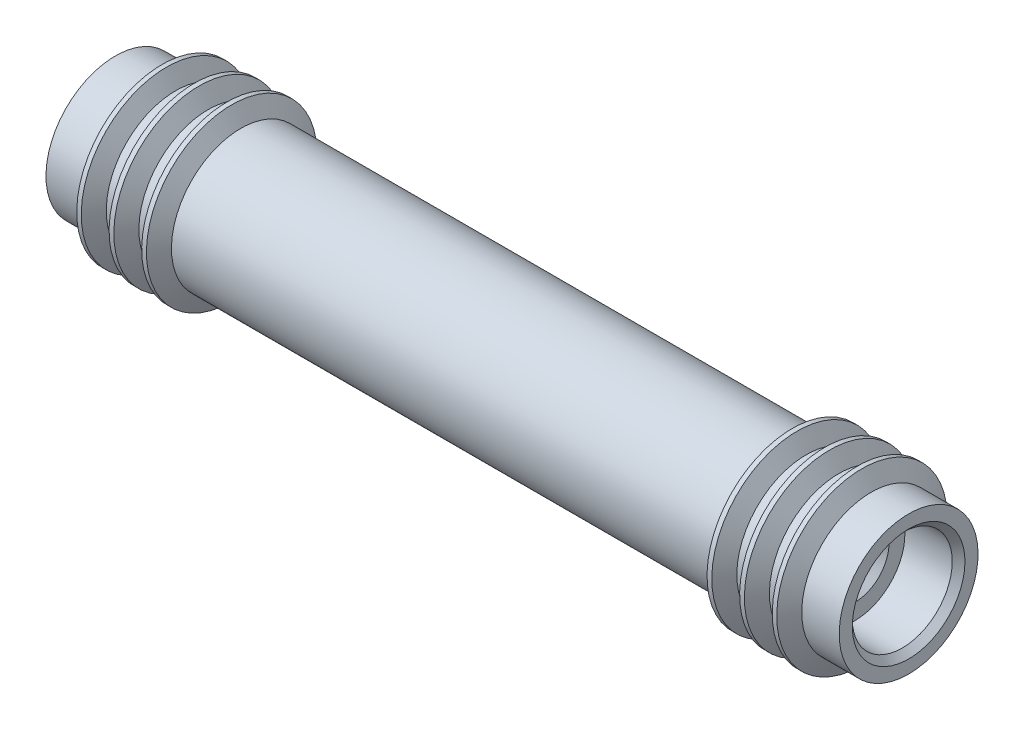
from build123d import *

# Parameters (mm, degrees)
CHAMFER1_SIZE = 0.508


with BuildPart() as part:
    # Sketch2 → Revolve1 (revolve)
    with BuildSketch(Plane.XY):
        Polygon((-28.75, 5.55625), (-31.75, 5.55625), (-31.75, 4), (-27.45, 4), (-27.45, 2.73), (-26.942, 2.222), (-26.942, 1.7145), (-21.925, 1.7145), (-21.925, 0), (0, 0), (0, 3.175), (0, 5.55625), (-21.705060633, 5.55625), (-22.438295474, 6.82625), (-22.819295474, 6.82625), (-23.552530316, 5.55625), (-24.314530316, 5.55625), (-25.047765158, 6.82625), (-25.428765158, 6.82625), (-26.162, 5.55625), (-26.924, 5.55625), (-27.657234842, 6.82625), (-28.016765158, 6.82625), align=None)
    revolve(axis=Axis((-31.75, 0, 0), (1, 0, 0)))

    # Chamfer1
    chamfer1_edges = [part.edges().sort_by_distance(p)[0] for p in [
        (-31.75, -4, 0),
    ]]
    chamfer(chamfer1_edges, length=CHAMFER1_SIZE)

    # Mirror1: part across plane


with BuildPart() as part_1:
    add(part.part)
    add(part.part.mirror(Plane(origin=(0, 0, 0), x_dir=(0, 0, 1), z_dir=(1, 0, 0))))


solid = part_1.part
